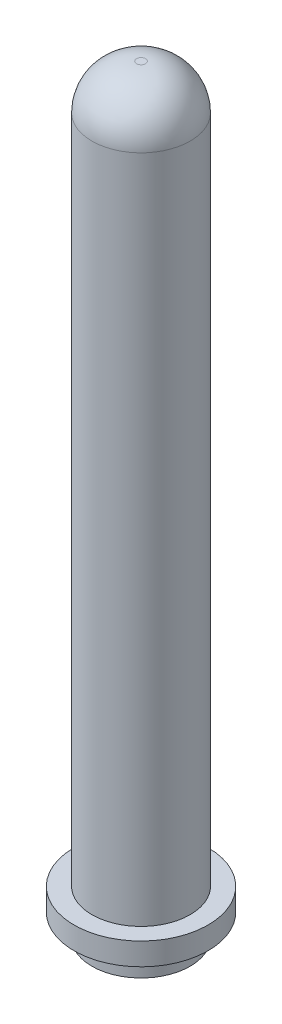
from build123d import *

# Parameters (mm, degrees)
STOCK_100996468_LAB1B_1_START         = 70
STOCK_100996468_LAB1B_1_OUTLINE_R     = 11
STOCK_100996468_LAB1B_1_DEPTH         = 170
STOCK_100996468_LAB1B_1_START_2       = 75
STOCK_100996468_LAB1B_1_2_OUTLINE_R   = 15
STOCK_100996468_LAB1B_1_2_OUTLINE_R_2 = 11
STOCK_100996468_LAB1B_1_2_DEPTH       = 5
FILLET1_R                             = 10


# Read off the part's stored shape, not the designer's step: Stock-100996468_Lab1B-1
with BuildPart() as part:
    # Stock-100996468_Lab1B-1 outline → Stock-100996468_Lab1B-1 (new body)
    with BuildSketch(Plane(origin=(0, 0, 0), x_dir=(1, 0, 0), z_dir=(0, 1, 0)).offset(STOCK_100996468_LAB1B_1_START)):
        with Locations((-62, 0)):
            Circle(STOCK_100996468_LAB1B_1_OUTLINE_R)
    extrude(amount=STOCK_100996468_LAB1B_1_DEPTH)

    # Stock-100996468_Lab1B-1 2 outline → Stock-100996468_Lab1B-1 2 (add)
    with BuildSketch(Plane(origin=(0, 0, 0), x_dir=(1, 0, 0), z_dir=(0, 1, 0)).offset(STOCK_100996468_LAB1B_1_START_2)):
        with Locations((-62, 0)):
            Circle(STOCK_100996468_LAB1B_1_2_OUTLINE_R)
        with Locations((-62, 0)):
            Circle(STOCK_100996468_LAB1B_1_2_OUTLINE_R_2, mode=Mode.SUBTRACT)
    extrude(amount=STOCK_100996468_LAB1B_1_2_DEPTH)

    # Fillet1
    fillet1_edges = [part.edges().sort_by_distance(p)[0] for p in [
        (-73, 240, 0),
    ]]
    fillet(fillet1_edges, radius=FILLET1_R)


solid = part.part
